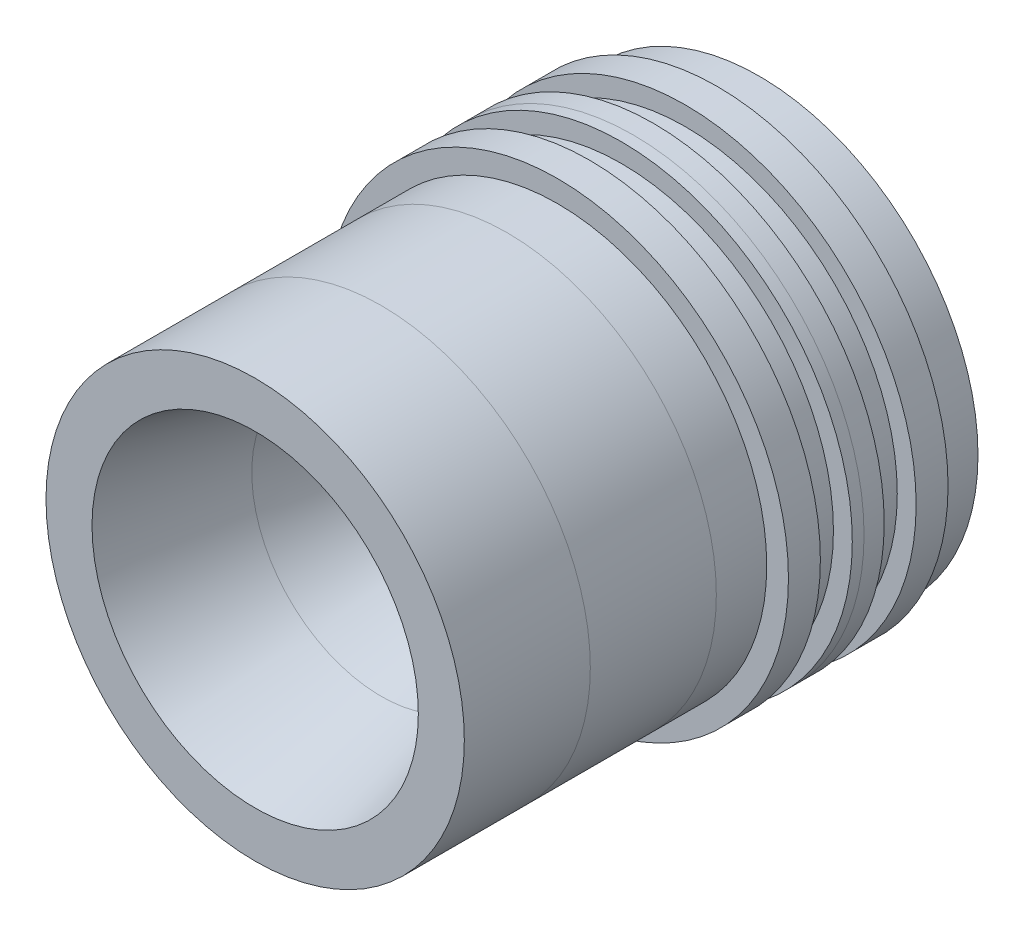
from build123d import *

# Parameters (mm, degrees)
SKETCH2_W          = 6.35
SKETCH2_H          = 9.652
SPLIT1_START       = -114.3
SPLIT1_2_OUTLINE_R = 69.8119
SPLIT1_2_DEPTH     = 114.3


# Read off the part's stored shape, not the designer's step: Split1
with BuildPart() as part:
    # Sketch1 → Revolve1 (revolve)
    with BuildSketch(Plane(origin=(0, 0, 0), x_dir=(1, 0, 0), z_dir=(0, 1, 0))):
        Polygon((69.8119, 139.7), (69.8119, 91.44), (63.246, 91.44), (63.246, 0), (49.337302706, 0), (17.145, 120.143309313), (17.145, 127.763309313), (59.817, 152.4), (66.167, 152.4), (66.167, 139.7), align=None)
    revolve(axis=Axis((0, 0, 8.145225657), (0, 0, -1)))

    # Sketch2 → Cut-Revolve1 (revolve, cut)
    with BuildSketch(Plane(origin=(0, 0, 0), x_dir=(1, 0, 0), z_dir=(0, 1, 0))):
        with Locations((67.2846, 125.222)):
            Rectangle(SKETCH2_W, SKETCH2_H)
        with Locations((67.2846, 105.918)):
            Rectangle(SKETCH2_W, SKETCH2_H)
    revolve(axis=Axis((0, 0, 8.145225657), (0, 0, -1)), mode=Mode.SUBTRACT)

    # Sketch3 → Cut-Revolve2 (revolve, cut)
    with BuildSketch(Plane(origin=(0, 0, 0), x_dir=(1, 0, 0), z_dir=(0, 1, 0))):
        Polygon((50.8, 147.194032623), (50.8, 126.670279827), (40.781051615, 69.85), (30.621051615, 69.85), (17.145, 120.143309313), (17.145, 127.763309313), align=None)
    revolve(axis=Axis((0, 0, 8.145225657), (0, 0, -1)), mode=Mode.SUBTRACT)

    # Split1 2 outline → Split1 2 (cut)
    with BuildSketch(Plane.XY.offset(SPLIT1_START)):
        Circle(SPLIT1_2_OUTLINE_R)
    extrude(amount=SPLIT1_2_DEPTH, mode=Mode.SUBTRACT)


with BuildPart() as body_2:
    # Split1 outline → Split1 (revolve)
    with BuildSketch(Plane.XZ):
        Polygon((49.337302706, 0), (39.128438475, -38.1), (63.246, -38.1), (63.246, 0), align=None)
    revolve(axis=Axis((0, 0, 0), (0, 0, 1)))


with BuildPart() as body_3:
    # Split1 3 outline → Split1 3 (revolve)
    with BuildSketch(Plane.XZ):
        Polygon((40.781051615, -69.85), (41.900727943, -76.2), (63.246, -76.2), (63.246, -38.1), (39.128438475, -38.1), (30.621051615, -69.85), align=None)
    revolve(axis=Axis((0, 0, 0), (0, 0, 1)))


with BuildPart() as body_4:
    # Split1 4 outline → Split1 4 (revolve)
    with BuildSketch(Plane.XZ):
        Polygon((41.900727943, -76.2), (48.618785908, -114.3), (69.8119, -114.3), (69.8119, -110.744), (64.1096, -110.744), (64.1096, -101.092), (69.8119, -101.092), (69.8119, -91.44), (63.246, -91.44), (63.246, -76.2), align=None)
    revolve(axis=Axis((0, 0, 0), (0, 0, 1)))


solid = Compound([part.part, body_2.part, body_3.part, body_4.part])
